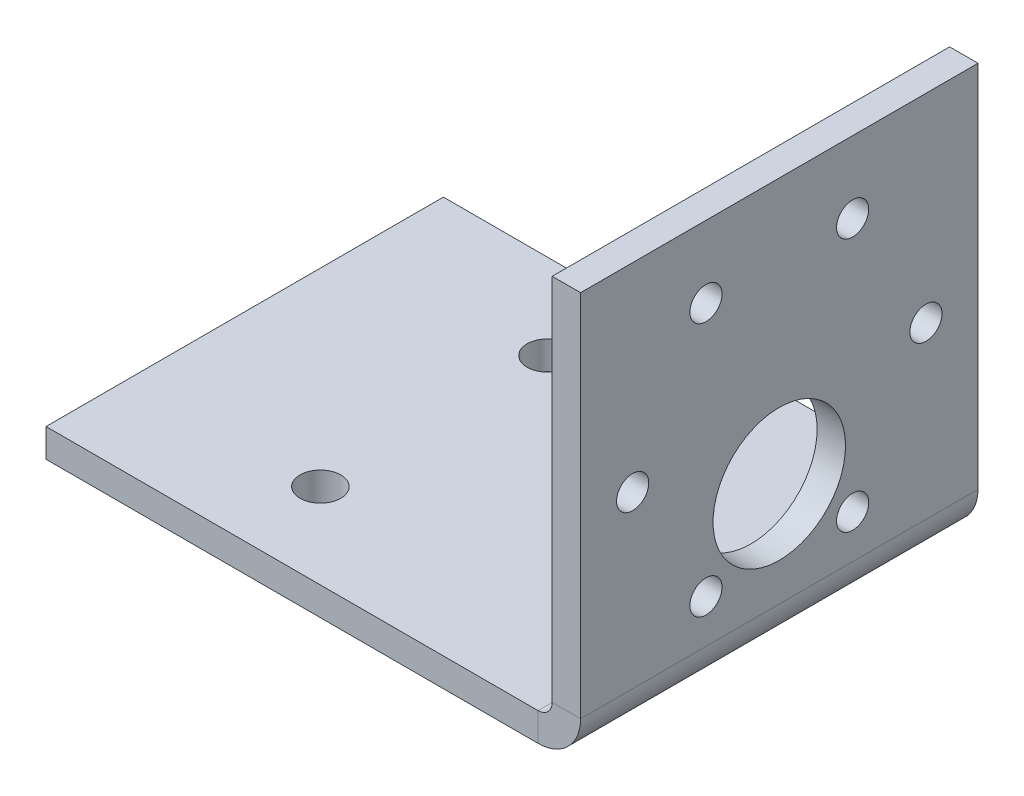
from build123d import *

# Parameters (mm, degrees)
SM_BRACKET_DEPTH     = 42
SK_MOTORHOLES_R      = 1.7
SK_MOTORHOLES_R_2    = 7
CUT_MOTORHOLES_DEPTH = 3
SK_RAILHOLES_R       = 2.15
CUT_RAILHOLES_DEPTH  = 30


# Sheet-metal steps are written as plain solids
with BuildPart() as part:
    # SK_Bracket → SM_Bracket (new body)
    with BuildSketch(Plane.XY.offset(-21)):
        with BuildLine():
            Line((0, 21), (0, -18))
            ThreePointArc((0, -18), (-0.439339828, -19.060660172), (-1.5, -19.5))
            Line((-1.5, -19.5), (-53.5, -19.5))
            Line((-53.5, -19.5), (-53.5, -22.5))
            Line((-53.5, -22.5), (-1.5, -22.5))
            ThreePointArc((-1.5, -22.5), (1.681980515, -21.181980515), (3, -18))
            Line((3, -18), (3, 21))
            Line((3, 21), (0, 21))
        make_face()
    extrude(amount=SM_BRACKET_DEPTH)

    # SK_MotorHoles → CUT_MotorHoles (cut)
    with BuildSketch(Plane(origin=(0, 0, 0), x_dir=(0, 0, -1), z_dir=(1, 0, 0))):
        with Locations((-15.5, 0)):
            Circle(SK_MOTORHOLES_R)
        with Locations((-7.75, 13.423393759)):
            Circle(SK_MOTORHOLES_R)
        with Locations((7.75, 13.423393759)):
            Circle(SK_MOTORHOLES_R)
        with Locations((15.5, 0)):
            Circle(SK_MOTORHOLES_R)
        with Locations((7.75, -13.423393759)):
            Circle(SK_MOTORHOLES_R)
        with Locations((-7.75, -13.423393759)):
            Circle(SK_MOTORHOLES_R)
        with Locations((0, -7)):
            Circle(SK_MOTORHOLES_R_2)
    extrude(amount=CUT_MOTORHOLES_DEPTH, mode=Mode.SUBTRACT)

    # SK_RailHoles → CUT_RailHoles (cut)
    with BuildSketch(Plane(origin=(0, 0, 0), x_dir=(1, 0, 0), z_dir=(0, 1, 0))):
        with Locations(Location((-33.5, -12, 0), (0, 0, 270))):
            Circle(SK_RAILHOLES_R)
        with Locations(Location((-33.5, 12, 0), (0, 0, 270))):
            Circle(SK_RAILHOLES_R)
    extrude(amount=-CUT_RAILHOLES_DEPTH, mode=Mode.SUBTRACT)


solid = part.part
